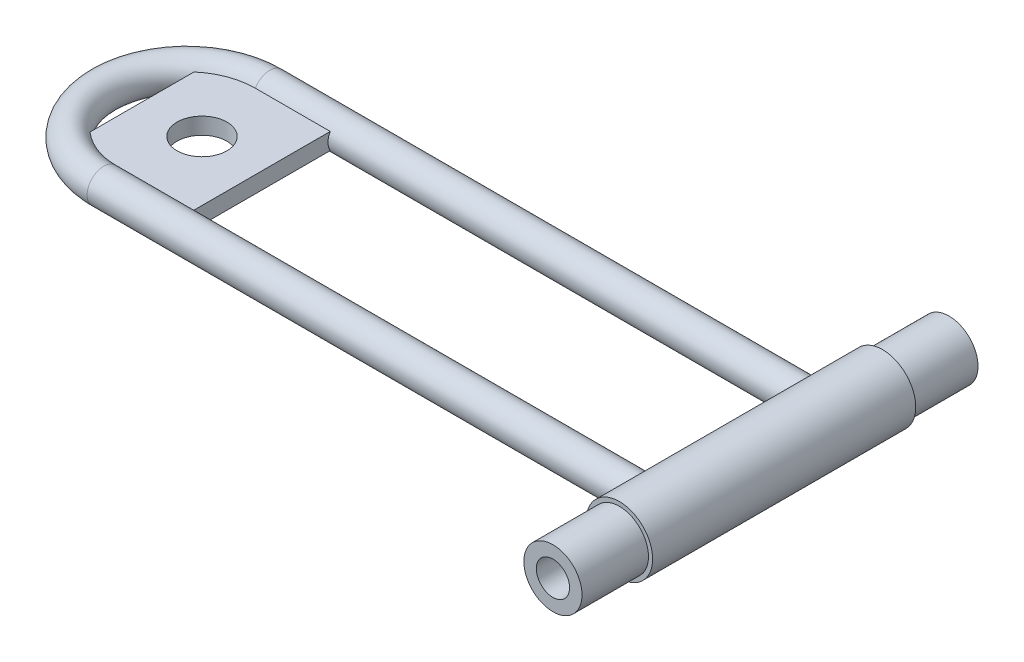
from build123d import *
from build123d.topology import SkipClean

# Parameters (mm, degrees)
SKETCH1_R           = 6.35
SKETCH1_R_2         = 3.175
BOSS_EXTRUDE1_DEPTH = 62.992
SKETCH3_R           = 3.175
SKETCH6_W           = 22.86
SKETCH6_H           = 3.175
BOSS_EXTRUDE3_DEPTH = 29.21
SKETCH7_R           = 4.7625
CUT_EXTRUDE1_DEPTH  = 29.21
BOSS_EXTRUDE5_START = 6.35
SKETCH9_R           = 6.35
SKETCH9_R_2         = 3.175
BOSS_EXTRUDE5_DEPTH = 6.35
CUT_EXTRUDE6_START  = -12.7
SKETCH10_R          = 6.35
SKETCH10_R_2        = 5.55625
CUT_EXTRUDE6_DEPTH  = 12.7
SKETCH12_R          = 6.35
SKETCH12_R_2        = 5.55625
CUT_EXTRUDE7_DEPTH  = 12.7


with BuildPart() as part:
    # Sketch1 → Boss-Extrude1 (new body)
    with BuildSketch(Plane.XY):
        Circle(SKETCH1_R)
        Circle(SKETCH1_R_2, mode=Mode.SUBTRACT)
    extrude(amount=BOSS_EXTRUDE1_DEPTH)

    # Sweep1: sweep along a path in Sketch4
    with BuildLine(Plane(origin=(0, 0, 0), x_dir=(1, 0, 0), z_dir=(0, 1, 0))) as sweep1_path:
        Line((-3.81, -15.663931971), (-107.95, -15.663931971))
        ThreePointArc((-107.95, -15.663931971), (-123.665226198, -31.37915817), (-107.95, -47.094384368))
        Line((-107.95, -47.094384368), (-3.81, -47.094384368))
    # Sketch3 → Sweep1 (sweep)
    with BuildSketch(Plane.ZY.offset(3.81)):
        with Locations((47.244, 0)):
            Circle(SKETCH3_R)
    sweep(path=sweep1_path.line)

    # Sketch6 → Boss-Extrude3 (add)
    with BuildSketch(Plane.XY.offset(15.24)):
        with Locations((-105.071320577, 0)):
            Rectangle(SKETCH6_W, SKETCH6_H)
    extrude(amount=BOSS_EXTRUDE3_DEPTH)

    # Sketch7 → Cut-Extrude1 (cut)
    with BuildSketch(Plane(origin=(0, 1.5875, 0), x_dir=(1, 0, 0), z_dir=(0, 1, 0))):
        with Locations((-105.071320577, -31.341130791)):
            Circle(SKETCH7_R)
    extrude(amount=-CUT_EXTRUDE1_DEPTH, mode=Mode.SUBTRACT)

    # Sketch9 → Boss-Extrude5 (add)
    with BuildSketch(Plane(origin=(0, 0, 0), x_dir=(-1, 0, 0), z_dir=(0, 0, -1)).offset(BOSS_EXTRUDE5_START)):
        Circle(SKETCH9_R)
        Circle(SKETCH9_R_2, mode=Mode.SUBTRACT)
    boss_extrude5 = extrude(amount=-BOSS_EXTRUDE5_DEPTH)

    # Mirror1: Boss-Extrude5 across plane
    with SkipClean():  # the faces are left unmerged after this step: merging them gives an invalid solid
        add(boss_extrude5.mirror(Plane.XY.offset(31.496)))

    # Sketch10 → Cut-Extrude6 (cut)
    with BuildSketch(Plane.XY.offset(69.342).offset(CUT_EXTRUDE6_START)):
        Circle(SKETCH10_R)
        Circle(SKETCH10_R_2, mode=Mode.SUBTRACT)
    extrude(amount=CUT_EXTRUDE6_DEPTH, mode=Mode.SUBTRACT)

    # Sketch12 → Cut-Extrude7 (cut)
    with BuildSketch(Plane(origin=(0, 0, -6.35), x_dir=(-1, 0, 0), z_dir=(0, 0, -1))):
        Circle(SKETCH12_R)
        Circle(SKETCH12_R_2, mode=Mode.SUBTRACT)
    extrude(amount=-CUT_EXTRUDE7_DEPTH, mode=Mode.SUBTRACT)


solid = part.part
